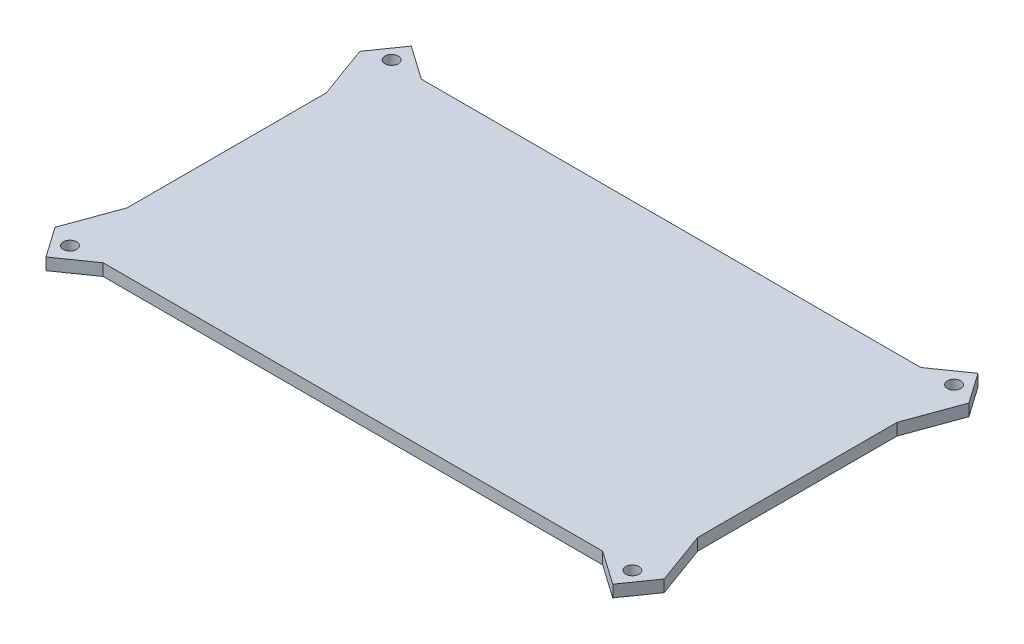
from build123d import *

# Parameters (mm, degrees)
MARKUP1_START                    = -6.35
MARKUP1_OUTLINE_R                = 3.3782
MARKUP1_DEPTH                    = 6.35
SKETCH2_W                        = 305.000000108
SKETCH2_H                        = 170.000000106
BOSS_EXTRUDE1_DEPTH              = 6.35
BOSS_EXTRUDE2_DEPTH              = 6.35
SKETCH5_W                        = 3.57124
SKETCH5_H                        = 6.35
F_1_4_CLEARANCE_HOLE1_AT_2_COUNT = 2
F_1_4_CLEARANCE_HOLE1_AT_2_PITCH = 300.583026684
F_1_4_CLEARANCE_HOLE1_AT_3_COUNT = 2
F_1_4_CLEARANCE_HOLE1_AT_3_PITCH = 346.255396975
F_1_4_CLEARANCE_HOLE1_AT_4_COUNT = 2
F_1_4_CLEARANCE_HOLE1_AT_4_PITCH = 171.879737036


# Read off the part's stored shape, not the designer's step: Markup1
with BuildPart() as part:
    # Markup1 outline → Markup1 (new body)
    with BuildSketch(Plane(origin=(0, 0, 0), x_dir=(1, 0, 0), z_dir=(0, 1, 0)).offset(MARKUP1_START)):
        Polygon((76.2, -82.55), (95.25, -63.5), (95.25, 63.5), (76.2, 82.55), (-76.2, 82.55), (-95.25, 63.5), (-95.25, -63.5), (-76.2, -82.55), align=None)
        with Locations((-78.75778, -66.05778)):
            Circle(MARKUP1_OUTLINE_R, mode=Mode.SUBTRACT)
        with Locations((78.75778, -66.05778)):
            Circle(MARKUP1_OUTLINE_R, mode=Mode.SUBTRACT)
        with Locations((-78.75778, 66.05778)):
            Circle(MARKUP1_OUTLINE_R, mode=Mode.SUBTRACT)
        with Locations((78.75778, 66.05778)):
            Circle(MARKUP1_OUTLINE_R, mode=Mode.SUBTRACT)
    extrude(amount=MARKUP1_DEPTH)


with BuildPart() as body_2:
    # Sketch2 → Boss-Extrude1 (new body)
    with BuildSketch(Plane(origin=(0, 0, 0), x_dir=(1, 0, 0), z_dir=(0, 1, 0))):
        Rectangle(SKETCH2_W, SKETCH2_H)
    extrude(amount=-BOSS_EXTRUDE1_DEPTH)

    # Sketch3 → Boss-Extrude2 (add)
    with BuildSketch(Plane.XZ.offset(6.35)):
        Polygon((133.450000054, 85.000000053), (133.450000054, 53.250000053), (152.500000054, 53.250000053), (162.75496375, 81.425281244), (151.4343574, 97.592782637), align=None)
        Polygon((152.500000054, -53.250000053), (133.450000054, -53.250000053), (133.450000054, -85.000000053), (151.4343574, -97.592782637), (162.75496375, -81.425281244), align=None)
        Polygon((-133.450000054, -85.000000053), (-133.450000054, -53.250000053), (-152.500000054, -53.250000053), (-162.75496375, -81.425281244), (-151.4343574, -97.592782637), align=None)
        Polygon((-152.500000054, 53.250000053), (-133.450000054, 53.250000053), (-133.450000054, 85.000000053), (-151.4343574, 97.592782637), (-162.75496375, 81.425281244), align=None)
    extrude(amount=-BOSS_EXTRUDE2_DEPTH)

    # Sketch5 → 1/4 Clearance Hole1 (revolve, cut)
    with BuildSketch(Plane(origin=(150.291513342, -6.35, -85.939868518), x_dir=(0, 0, -1), z_dir=(1, 0, 0))):
        with Locations((1.78562, 3.175)):
            Rectangle(SKETCH5_W, SKETCH5_H)
    f_1_4_clearance_hole1 = revolve(axis=Axis((150.291513342, -12.7, -85.939868518), (0, 1, 0)), mode=Mode.SUBTRACT)

    # 1/4 Clearance Hole1 at 2: 1/4 Clearance Hole1 ×2
    with Locations(*[(-i * F_1_4_CLEARANCE_HOLE1_AT_2_PITCH, 0, 0) for i in range(1, F_1_4_CLEARANCE_HOLE1_AT_2_COUNT)]):
        add(f_1_4_clearance_hole1, mode=Mode.SUBTRACT)

    # 1/4 Clearance Hole1 at 3: 1/4 Clearance Hole1 ×2
    with Locations(*[Vector(-0.8680962934015001, 0, 0.49639583537996856) * (i * F_1_4_CLEARANCE_HOLE1_AT_3_PITCH) for i in range(1, F_1_4_CLEARANCE_HOLE1_AT_3_COUNT)]):
        add(f_1_4_clearance_hole1, mode=Mode.SUBTRACT)

    # 1/4 Clearance Hole1 at 4: 1/4 Clearance Hole1 ×2
    with Locations(*[(0, 0, i * F_1_4_CLEARANCE_HOLE1_AT_4_PITCH) for i in range(1, F_1_4_CLEARANCE_HOLE1_AT_4_COUNT)]):
        add(f_1_4_clearance_hole1, mode=Mode.SUBTRACT)


solid = Compound([part.part, body_2.part])
